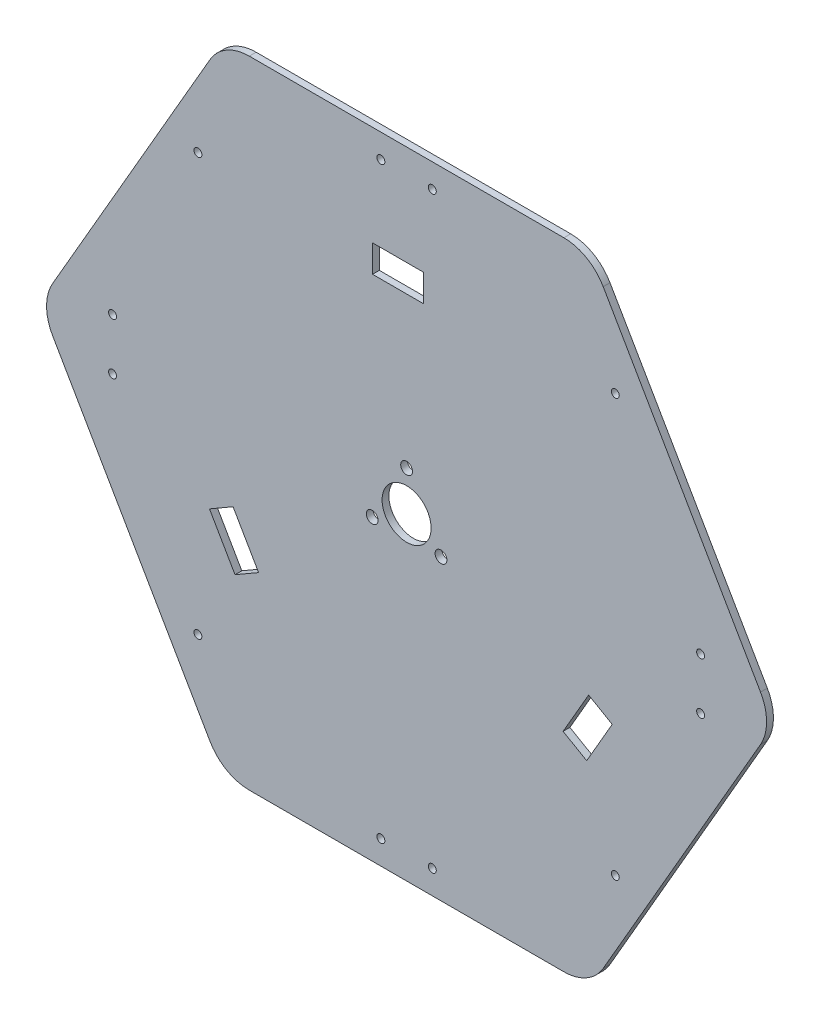
from build123d import *

# Parameters (mm, degrees)
CROQUIS1_R              = 2.6
CROQUIS1_W              = 22.5
CROQUIS1_H              = 12
CROQUIS1_R_2            = 10.8
SALIENTE_EXTRUIR1_DEPTH = 3
REDONDEO1_R             = 20
CROQUIS3_R              = 1.75
CORTAR_EXTRUIR1_DEPTH   = 212.545651301
MATRIZC1_COUNT          = 4


with BuildPart() as part:
    # Croquis1 → Saliente-Extruir1 (new body)
    with BuildSketch(Plane.XY):
        Polygon((-80.829037687, -140), (80.829037687, -140), (161.658075373, 0), (80.829037687, 140), (-80.829037687, 140), (-161.658075373, 0), align=None)
        with Locations((0, 17.5)):
            Circle(CROQUIS1_R, mode=Mode.SUBTRACT)
        Polygon((-65.178446292, -54.951301588), (-75.570751138, -60.951301588), (-86.820751138, -41.465730003), (-76.428446292, -35.465730003), align=None, mode=Mode.SUBTRACT)
        with Locations((-15.155444566, -8.75)):
            Circle(CROQUIS1_R, mode=Mode.SUBTRACT)
        Polygon((80.178446292, -28.970539474), (90.570751138, -34.970539474), (79.320751138, -54.456111059), (68.928446292, -48.456111059), align=None, mode=Mode.SUBTRACT)
        with Locations((15.155444566, -8.75)):
            Circle(CROQUIS1_R, mode=Mode.SUBTRACT)
        with Locations((-3.75, 89.921841062)):
            Rectangle(CROQUIS1_W, CROQUIS1_H, mode=Mode.SUBTRACT)
        Circle(CROQUIS1_R_2, mode=Mode.SUBTRACT)
    extrude(amount=SALIENTE_EXTRUIR1_DEPTH)

    # Redondeo1
    redondeo1_edges = [part.edges().sort_by_distance(p)[0] for p in [
        (80.829037687, 140, 1.5),
        (-80.829037687, 140, 1.5),
        (-161.658075373, 0, 1.5),
        (-80.829037687, -140, 1.5),
        (80.829037687, -140, 1.5),
        (161.658075373, 0, 1.5),
    ]]
    fillet(redondeo1_edges, radius=REDONDEO1_R)

    # Croquis3 → Cortar-Extruir1 (cut, through all)
    with BuildSketch(Plane(origin=(0, 0, 0), x_dir=(1, 0, 0), z_dir=(0, 0, -1))):
        with Locations((129.505310752, 11.330246557)):
            Circle(CROQUIS3_R)
        with Locations((91.923881554, 91.923881554)):
            Circle(CROQUIS3_R)
        with Locations((11.330246557, 129.505310752)):
            Circle(CROQUIS3_R)
    cortar_extruir1 = extrude(amount=-CORTAR_EXTRUIR1_DEPTH, mode=Mode.SUBTRACT)

    # MatrizC1: Cortar-Extruir1 ×4 about axis
    matrizc1_axis = Axis((0, 0, 0), (0, 0, 1))
    for i in range(1, MATRIZC1_COUNT):
        add(cortar_extruir1.rotate(matrizc1_axis, i * 360 / MATRIZC1_COUNT), mode=Mode.SUBTRACT)


solid = part.part
